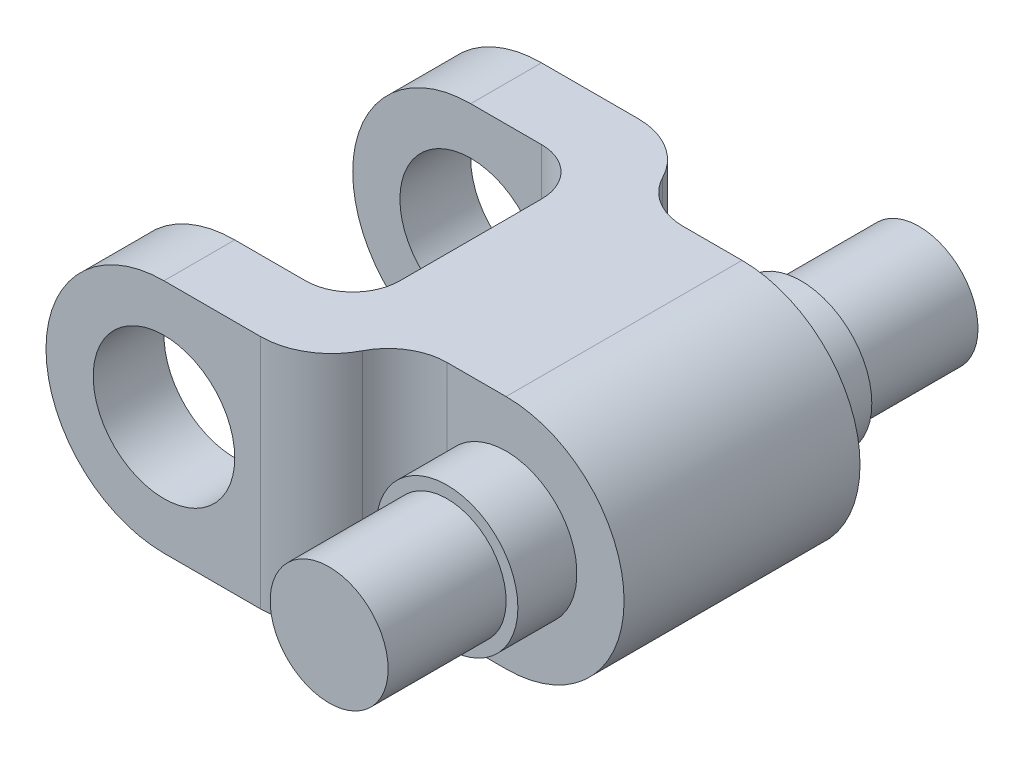
from build123d import *

# Parameters (mm, degrees)
SKETCH1_R               = 3
BOSS_EXTRUDE1_DEPTH     = 5
SKETCH1_3_R             = 3
BOSS_EXTRUDE2_DEPTH     = 7.5
SKETCH1_4_R             = 2.5
BOSS_EXTRUDE3_DEPTH     = 12.5
BOSS_EXTRUDE4_DEPTH     = 8
CUT_EXTRUDE1_DEPTH      = 23.989127865
CUT_EXTRUDE1_DEPTH_BACK = 23.989127865
SKETCH6_W               = 10
SKETCH6_H               = 10
SKETCH7_R               = 3
CUT_EXTRUDE2_DEPTH      = 27.786190472
FILLET4_R               = 2.5
FILLET5_R               = 3
FILLET6_R               = 2


# Some blends are built 0.0001 mm under size
with BuildPart() as part:
    # Sketch1 → Boss-Extrude1 (new, symmetric)
    with BuildSketch(Plane.XY):
        with BuildLine():
            ThreePointArc((0, 5), (5, 0), (0, -5))
            Line((0, -5), (-5, -5))
            Line((-5, -5), (-5, 5))
            Line((-5, 5), (0, 5))
        make_face()
        Circle(SKETCH1_R, mode=Mode.SUBTRACT)
    extrude(amount=BOSS_EXTRUDE1_DEPTH, both=True)

    # Sketch1<3> → Boss-Extrude2 (add, symmetric)
    with BuildSketch(Plane.XY):
        Circle(SKETCH1_3_R)
    extrude(amount=BOSS_EXTRUDE2_DEPTH, both=True)

    # Sketch1<4> → Boss-Extrude3 (add, symmetric)
    with BuildSketch(Plane.XY):
        Circle(SKETCH1_4_R)
    extrude(amount=BOSS_EXTRUDE3_DEPTH, both=True)

    # Sketch5 → Boss-Extrude4 (add, symmetric)
    with BuildSketch(Plane.XY):
        with BuildLine():
            Line((-5, 5), (-5, -5))
            Line((-5, -5), (-11.5, -5))
            ThreePointArc((-11.5, -5), (-16.5, 0), (-11.5, 5))
            Line((-11.5, 5), (-5, 5))
        make_face()
    extrude(amount=BOSS_EXTRUDE4_DEPTH, both=True)

    # Sketch6 → Cut-Extrude1 (cut, two sides: drawn at the far end of the back side and taken through both)
    with BuildSketch(Plane(origin=(0, 5, 0), x_dir=(1, 0, 0), z_dir=(0, 1, 0)).offset(-CUT_EXTRUDE1_DEPTH_BACK)):
        with Locations((-11.5, 0)):
            Rectangle(SKETCH6_W, SKETCH6_H)
    extrude(amount=CUT_EXTRUDE1_DEPTH + CUT_EXTRUDE1_DEPTH_BACK, mode=Mode.SUBTRACT)

    # Sketch7 → Cut-Extrude2 (cut, through all)
    with BuildSketch(Plane(origin=(0, 0, -8), x_dir=(-1, 0, 0), z_dir=(0, 0, -1))):
        with Locations((11.5, 0)):
            Circle(SKETCH7_R)
    extrude(amount=-CUT_EXTRUDE2_DEPTH, mode=Mode.SUBTRACT)

    # Fillet4
    # the kernel refuses this fillet: 2.5 mm, written as the material it adds along each edge
    with BuildSketch(Plane(origin=(-5, -5, 5), x_dir=(0, 0, 1), z_dir=(0, 1, 0)), Plane(origin=(-5, -5, -5), x_dir=(1, 0, 0), z_dir=(0, 1, 0))) as fillet4_piece_1:
        with BuildLine():
            CenterArc((FILLET4_R, FILLET4_R), FILLET4_R, 180, 90)
            Line((0, FILLET4_R), (0, 0))
            Line((0, 0), (FILLET4_R, 0))
        make_face()
    extrude(amount=10)

    # Fillet5
    fillet5_edges = [part.edges().sort_by_distance(p)[0] for p in [
        (-5, 0, -8),
        (-5, 0, 8),
    ]]
    fillet(fillet5_edges, radius=FILLET5_R)

    # Fillet6
    fillet6_edges = [part.edges().sort_by_distance(p)[0] for p in [
        (-6.5, 0, -5),
        (-6.5, 0, 5),
    ]]
    fillet(fillet6_edges, radius=FILLET6_R - 0.0001)  # a hair under: the kernel refuses the full size


solid = part.part
